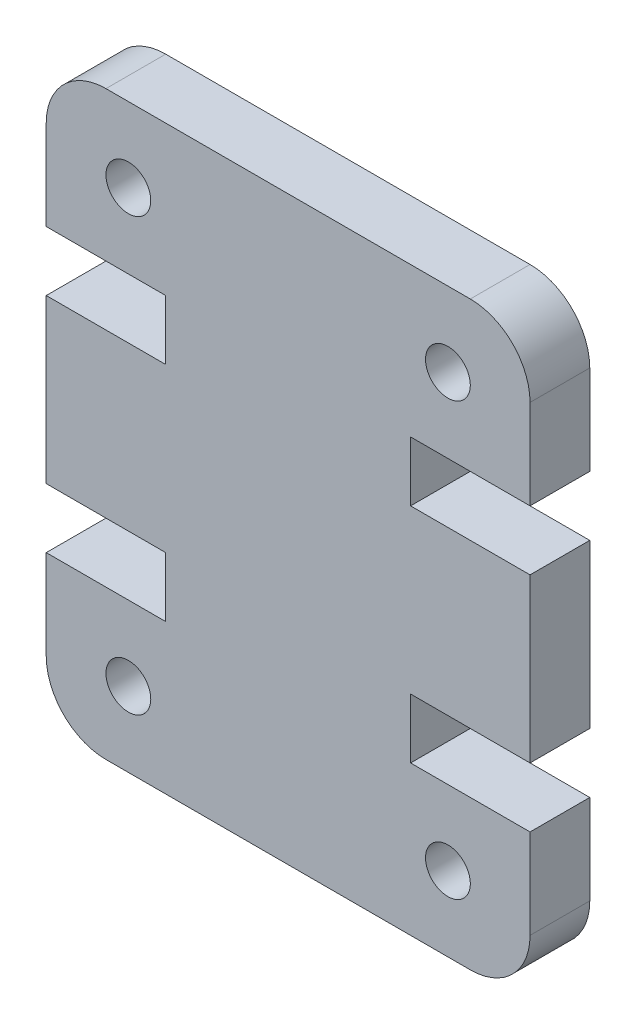
from build123d import *

# Parameters (mm, degrees)
SKETCH2_R           = 0.75
BOSS_EXTRUDE1_DEPTH = 2


with BuildPart() as part:
    # Sketch2 → Boss-Extrude1 (new body)
    with BuildSketch(Plane.XY):
        with BuildLine():
            Line((0, 7), (0, 12.455))
            Line((0, 12.455), (4, 12.455))
            Line((4, 12.455), (4, 14.455))
            Line((4, 14.455), (0, 14.455))
            Line((0, 14.455), (0, 17.455))
            ThreePointArc((0, 17.455), (0.585786438, 18.869213562), (2, 19.455))
            Line((2, 19.455), (14.2, 19.455))
            ThreePointArc((14.2, 19.455), (15.614213562, 18.869213562), (16.2, 17.455))
            Line((16.2, 17.455), (16.2, 14.455))
            Line((16.2, 14.455), (12.2, 14.455))
            Line((12.2, 14.455), (12.2, 12.455))
            Line((12.2, 12.455), (16.2, 12.455))
            Line((16.2, 12.455), (16.2, 7))
            Line((16.2, 7), (12.2, 7))
            Line((12.2, 7), (12.2, 5))
            Line((12.2, 5), (16.2, 5))
            Line((16.2, 5), (16.2, 2))
            ThreePointArc((16.2, 2), (15.614213562, 0.585786438), (14.2, 0))
            Line((14.2, 0), (2, 0))
            ThreePointArc((2, 0), (0.585786438, 0.585786438), (0, 2))
            Line((0, 2), (0, 5))
            Line((0, 5), (4, 5))
            Line((4, 5), (4, 7))
            Line((4, 7), (0, 7))
        make_face()
        with Locations((13.45, 2.5)):
            Circle(SKETCH2_R, mode=Mode.SUBTRACT)
        with Locations((2.75, 16.955)):
            Circle(SKETCH2_R, mode=Mode.SUBTRACT)
        with Locations((2.75, 2.5)):
            Circle(SKETCH2_R, mode=Mode.SUBTRACT)
        with Locations((13.45, 16.955)):
            Circle(SKETCH2_R, mode=Mode.SUBTRACT)
    extrude(amount=BOSS_EXTRUDE1_DEPTH)


solid = part.part
